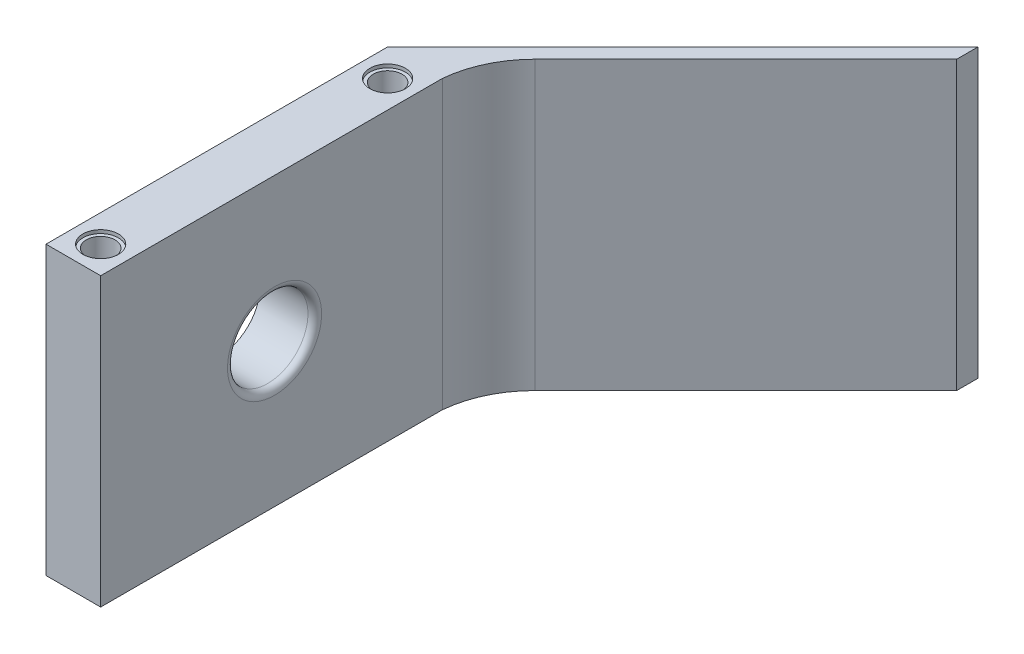
from build123d import *

# Parameters (mm, degrees)
SKETCH1_W           = 25
SKETCH1_H           = 50
SKETCH1_R           = 3.4
BOSS_EXTRUDE1_DEPTH = 3
SKETCH2_W           = 50
SKETCH2_H           = 3
BOSS_EXTRUDE2_DEPTH = 8
SKETCH3_W           = 8
SKETCH3_H           = 50
BOSS_EXTRUDE3_DEPTH = 42
SKETCH4_R           = 2.65
CUT_EXTRUDE1_DEPTH  = 0.5
SKETCH5_R           = 5.888972746
CUT_EXTRUDE2_DEPTH  = 9
FILLET2_R           = 1
SKETCH6_R           = 12.6
BOSS_EXTRUDE4_DEPTH = 2
FILLET4_R           = 1
SKETCH8_R           = 1.589780168
SKETCH8_R_2         = 1.777428262
CUT_EXTRUDE3_DEPTH  = 10
SKETCH9_W           = 49.021678163
SKETCH9_H           = 20.976854622
CUT_EXTRUDE4_DEPTH  = 68.79439129
SKETCH11_R          = 2.1
CUT_EXTRUDE5_DEPTH  = 59.480168703
SKETCH14_R          = 2.6
CUT_EXTRUDE6_DEPTH  = 0.5
BOSS_EXTRUDE5_DEPTH = 42
FILLET5_R           = 15


with BuildPart() as part:
    # Sketch1 → Boss-Extrude1 (new body)
    with BuildSketch(Plane(origin=(0, 0, 0), x_dir=(1, 0, 0), z_dir=(0, 1, 0))):
        with Locations((2.276951673, 11.384758364)):
            Rectangle(SKETCH1_W, SKETCH1_H)
        with Locations(Location((1.276951673, 11.384758364, 0), (0, 0, 270))):
            Circle(SKETCH1_R, mode=Mode.SUBTRACT)
    extrude(amount=BOSS_EXTRUDE1_DEPTH)

    # Sketch2 → Boss-Extrude2 (add)
    with BuildSketch(Plane.ZY.offset(10.223048327)):
        with Locations((-11.384758364, 1.5)):
            Rectangle(SKETCH2_W, SKETCH2_H)
    extrude(amount=BOSS_EXTRUDE2_DEPTH)

    # Sketch3 → Boss-Extrude3 (add)
    with BuildSketch(Plane.XZ):
        with Locations((-14.223048327, -11.384758364)):
            Rectangle(SKETCH3_W, SKETCH3_H)
    extrude(amount=BOSS_EXTRUDE3_DEPTH)

    # Sketch4 → Cut-Extrude1 (cut)
    with BuildSketch(Plane(origin=(0, 3, 0), x_dir=(1, 0, 0), z_dir=(0, 1, 0))):
        with Locations(Location((-14.223048327, 32.384758364, 0), (0, 0, 270))):
            Circle(SKETCH4_R)
        with Locations(Location((-14.223048327, -9.615241636, 0), (0, 0, 270))):
            Circle(SKETCH4_R)
    cut_extrude1 = extrude(amount=-CUT_EXTRUDE1_DEPTH, mode=Mode.SUBTRACT)

    # Mirror1: Cut-Extrude1 across plane
    add(cut_extrude1.mirror(Plane.ZX.offset(-19.5)), mode=Mode.SUBTRACT)

    # Sketch5 → Cut-Extrude2 (cut)
    with BuildSketch(Plane.ZY.offset(18.223048327)):
        with Locations((-11.836279124, -21)):
            Circle(SKETCH5_R)
    extrude(amount=-CUT_EXTRUDE2_DEPTH, mode=Mode.SUBTRACT)

    # Fillet2
    fillet2_edges = [part.edges().sort_by_distance(p)[0] for p in [
        (-10.223048327, -21, -17.72525187),
    ]]
    fillet(fillet2_edges, radius=FILLET2_R)

    # Mirror2: Cut-Extrude1 across plane
    add(cut_extrude1.mirror(Plane.ZY.offset(1.723048327)), mode=Mode.SUBTRACT)

    # Sketch6 → Boss-Extrude4 (add)
    with BuildSketch(Plane(origin=(0, 3, 0), x_dir=(1, 0, 0), z_dir=(0, 1, 0))):
        with BuildLine():
            Line((14.776951673, 5.825082115), (14.776951673, 16.944434614))
            ThreePointArc((14.776951673, 16.944434614), (-13.323048327, 11.384758364), (14.776951673, 5.825082115))
        make_face()
        with Locations(Location((1.276951673, 11.384758364, 0), (0, 0, 270))):
            Circle(SKETCH6_R, mode=Mode.SUBTRACT)
    extrude(amount=BOSS_EXTRUDE4_DEPTH)

    # Fillet4
    # the kernel refuses this fillet: 1 mm, written as the material it takes off along each edge
    with BuildSketch(Plane(origin=(14.776951673, 5, -3.325082115), x_dir=(0, -1, 0), z_dir=(0, 0, -1))) as fillet4_piece_1:
        with BuildLine():
            CenterArc((FILLET4_R, FILLET4_R), FILLET4_R, 180, 90)
            Line((0, FILLET4_R), (0, 0))
            Line((0, 0), (FILLET4_R, 0))
        make_face()
    extrude(amount=16.119352499, mode=Mode.SUBTRACT)

    # Sketch8 → Cut-Extrude3 (cut)
    with BuildSketch(Plane(origin=(0, 3, 0), x_dir=(1, 0, 0), z_dir=(0, 1, 0))):
        with Locations(Location((1.276951673, 19.884758364, 0), (0, 0, 270))):
            Circle(SKETCH8_R)
        with Locations(Location((1.276951673, 2.884758364, 0), (0, 0, 270))):
            Circle(SKETCH8_R_2)
    extrude(amount=-CUT_EXTRUDE3_DEPTH, mode=Mode.SUBTRACT)

    # Sketch9 → Cut-Extrude4 (cut, through all)
    with BuildSketch(Plane.XY.offset(13.615241636)):
        with Locations((-9.733887409, 10.488427311)):
            Rectangle(SKETCH9_W, SKETCH9_H)
    extrude(amount=-CUT_EXTRUDE4_DEPTH, mode=Mode.SUBTRACT)

    # Sketch11 → Cut-Extrude5 (cut, through all)
    with BuildSketch(Plane(origin=(0, 0, 0), x_dir=(1, 0, 0), z_dir=(0, 1, 0))):
        with Locations(Location((-14.223048327, 32.384758364, 0), (0, 0, 270))):
            Circle(SKETCH11_R)
    cut_extrude5 = extrude(amount=-CUT_EXTRUDE5_DEPTH, mode=Mode.SUBTRACT)

    # Mirror3: Cut-Extrude5 across plane
    add(cut_extrude5.mirror(Plane.XY.offset(-11.384758364)), mode=Mode.SUBTRACT)

    # Sketch14 → Cut-Extrude6 (cut)
    with BuildSketch(Plane(origin=(0, 0, 0), x_dir=(1, 0, 0), z_dir=(0, 1, 0))):
        with Locations(Location((-14.223048327, -9.615241636, 0), (0, 0, 270))):
            Circle(SKETCH14_R)
    cut_extrude6 = extrude(amount=-CUT_EXTRUDE6_DEPTH, mode=Mode.SUBTRACT)

    # Mirror4: Cut-Extrude6 across plane
    add(cut_extrude6.mirror(Plane.XY.offset(-11.384758364)), mode=Mode.SUBTRACT)

    # Sketch15 → Boss-Extrude5 (add)
    with BuildSketch(Plane(origin=(0, 0, 0), x_dir=(1, 0, 0), z_dir=(0, 1, 0))):
        Polygon((-18.223048327, 36.384758364), (24.976951673, 79.584758364), (24.976951673, 76.472221629), (-15.110511592, 36.384758364), align=None)
    extrude(amount=-BOSS_EXTRUDE5_DEPTH)

    # Fillet5
    # the kernel refuses this fillet: 15 mm, written as the material it adds along each edge
    with BuildSketch(Plane(origin=(-15.110511592, 0, -36.384758364), x_dir=(1, 0, 0), z_dir=(0, -1, 0))) as fillet5_piece_1:
        with BuildLine():
            CenterArc((19.822892097, 1.390311339), FILLET5_R, 185.31823153, 39.68176847)
            Line((9.216290379, -9.216290379), (0, 0))
            Line((0, 0), (4.887463265, 0))
        make_face()
    extrude(amount=42)


solid = part.part
